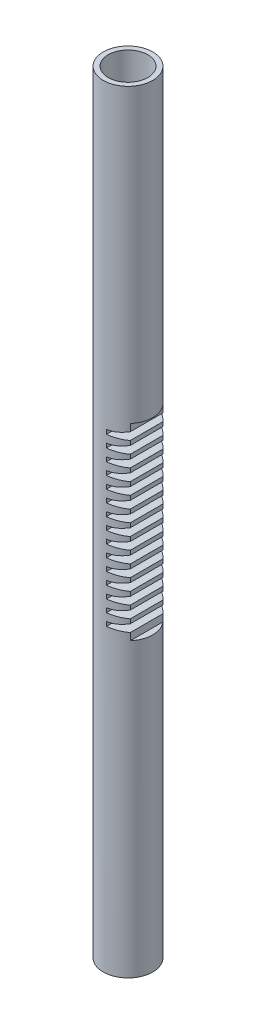
from build123d import *

# Parameters (mm, degrees)
SKETCH1_R               = 12.4875
BOSS_EXTRUDE1_DEPTH     = 375
CUT_EXTRUDE1_DEPTH      = 18
CUT_EXTRUDE1_DEPTH_BACK = 29
CUT_EXTRUDE2_START      = -20
CUT_EXTRUDE2_DEPTH      = 33
LPATTERN1_COUNT         = 8
LPATTERN1_PITCH         = 6
LPATTERN1_COUNT_DIR2    = 8
LPATTERN1_PITCH_DIR2    = 6
SKETCH4_R               = 10
CUT_EXTRUDE3_DEPTH      = 135
CUT_EXTRUDE4_START      = -135
SKETCH5_R               = 10
CUT_EXTRUDE4_DEPTH      = 135
SKETCH6_R               = 12.4875
SKETCH6_R_2             = 10
BOSS_EXTRUDE2_DEPTH     = 7.5
BOSS_EXTRUDE3_START     = 7.5
SKETCH7_R               = 12.4875
SKETCH7_R_2             = 10
BOSS_EXTRUDE3_DEPTH     = 7.5
CUT_EXTRUDE5_DEPTH      = 10
CUT_EXTRUDE5_DEPTH_BACK = 10
SKETCH9_W               = 3.5
SKETCH9_H               = 95


with BuildPart() as part:
    # Sketch1 → Boss-Extrude1 (new body)
    with BuildSketch(Plane(origin=(0, 0, 0), x_dir=(1, 0, 0), z_dir=(0, 1, 0))):
        Circle(SKETCH1_R)
    extrude(amount=BOSS_EXTRUDE1_DEPTH)

    # Sketch2 → Cut-Extrude1 (cut, two sides: drawn at the far end of the back side and taken through both)
    with BuildSketch(Plane.XY.offset(-CUT_EXTRUDE1_DEPTH_BACK)):
        Polygon((12.4875, 187.5), (12.4875, 235), (9.4, 235), (9.4, 140), (12.4875, 140), align=None)
    extrude(amount=CUT_EXTRUDE1_DEPTH + CUT_EXTRUDE1_DEPTH_BACK, mode=Mode.SUBTRACT)

    # Sketch3 → Cut-Extrude2 (cut)
    with BuildSketch(Plane.XY.offset(CUT_EXTRUDE2_START)):
        with BuildLine():
            Line((9.4, 189.41608397), (9.4, 185.58391603))
            ThreePointArc((9.4, 185.58391603), (5.469524113, 186.180958777), (1.5, 186.4))
            Line((1.5, 186.4), (1.5, 188.6))
            ThreePointArc((1.5, 188.6), (5.469524113, 188.819041223), (9.4, 189.41608397))
        make_face()
    cut_extrude2 = extrude(amount=CUT_EXTRUDE2_DEPTH, mode=Mode.SUBTRACT)

    # LPattern1: Cut-Extrude2 8 × 8
    with Locations(*[Vector(0, 1, 0) * (i * LPATTERN1_PITCH) + Vector(0, -1, 0) * (j * LPATTERN1_PITCH_DIR2) for i in range(LPATTERN1_COUNT) for j in range(LPATTERN1_COUNT_DIR2) if (i, j) != (0, 0)]):
        add(cut_extrude2, mode=Mode.SUBTRACT)

    # Sketch4 → Cut-Extrude3 (cut)
    with BuildSketch(Plane.XZ):
        Circle(SKETCH4_R)
    extrude(amount=-CUT_EXTRUDE3_DEPTH, mode=Mode.SUBTRACT)

    # Sketch5 → Cut-Extrude4 (cut)
    with BuildSketch(Plane(origin=(0, 375, 0), x_dir=(1, 0, 0), z_dir=(0, 1, 0)).offset(CUT_EXTRUDE4_START)):
        Circle(SKETCH5_R)
    extrude(amount=CUT_EXTRUDE4_DEPTH, mode=Mode.SUBTRACT)

    # Sketch6 → Boss-Extrude2 (add)
    with BuildSketch(Plane(origin=(0, 375, 0), x_dir=(1, 0, 0), z_dir=(0, 1, 0))):
        Circle(SKETCH6_R)
        Circle(SKETCH6_R_2, mode=Mode.SUBTRACT)
    extrude(amount=BOSS_EXTRUDE2_DEPTH)

    # Sketch7 → Boss-Extrude3 (add)
    with BuildSketch(Plane.XZ.offset(BOSS_EXTRUDE3_START)):
        Circle(SKETCH7_R)
        Circle(SKETCH7_R_2, mode=Mode.SUBTRACT)
    extrude(amount=-BOSS_EXTRUDE3_DEPTH)

    # Sketch9 → Cut-Extrude5 (cut, two sides: drawn at the far end of the back side and taken through both)
    with BuildSketch(Plane.XY.offset(-CUT_EXTRUDE5_DEPTH_BACK)):
        with Locations((-10.7375, 187.329517739)):
            Rectangle(SKETCH9_W, SKETCH9_H)
    extrude(amount=CUT_EXTRUDE5_DEPTH + CUT_EXTRUDE5_DEPTH_BACK, mode=Mode.SUBTRACT)


solid = part.part
